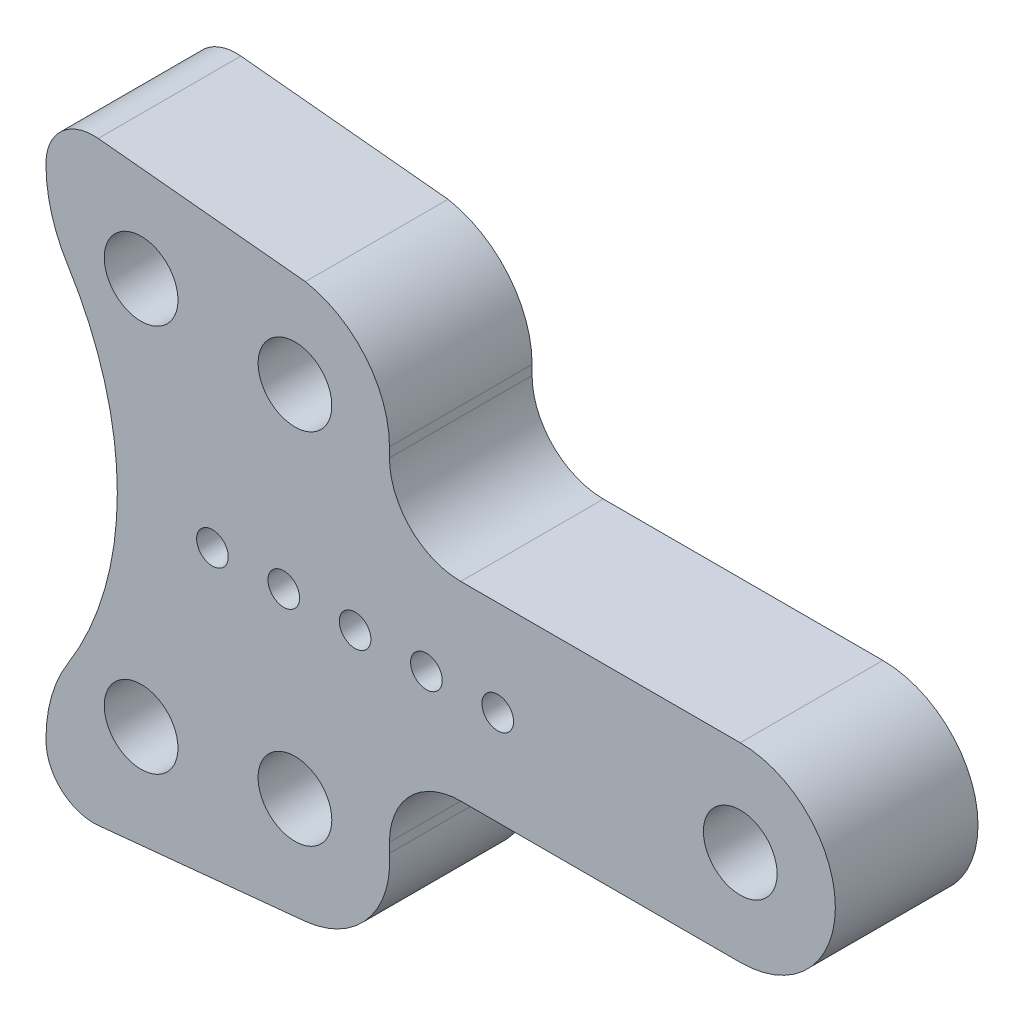
from build123d import *

# Parameters (mm, degrees)
SZKIC1_R                    = 1.55
DODANIE_WYCI_GNI_CIE1_DEPTH = 6
DODANIE_WYCI_GNI_CIE2_DEPTH = 6
WYTNIJ_WYCI_GNI_CIE3_START  = -10
SZKIC2_R                    = 0.665
SZKIC2_R_2                  = 1.55
WYTNIJ_WYCI_GNI_CIE3_DEPTH  = 10
SZYK_LINIOWY1_OUTLINE_R     = 0.665
SZYK_LINIOWY1_DEPTH         = 6
SZKIC6_R                    = 1.55
WYTNIJ_WYCI_GNI_CIE6_DEPTH  = 6


# Read off the part's stored shape, not the designer's step: Szyk liniowy1
with BuildPart() as part:
    # Szkic1 → Dodanie-wyciągnięcie1 (new body)
    with BuildSketch(Plane.XY):
        with BuildLine():
            Line((-166.275426397, 1549.053482816), (-188.475426397, 1549.053482816))
            ThreePointArc((-188.475426397, 1549.053482816), (-192.475426397, 1553.053482816), (-188.475426397, 1557.053482816))
            Line((-188.475426397, 1557.053482816), (-166.275426397, 1557.053482816))
            ThreePointArc((-166.275426397, 1557.053482816), (-162.275426397, 1553.053482816), (-166.275426397, 1549.053482816))
        make_face()
        with Locations((-166.275426397, 1553.053482816)):
            Circle(SZKIC1_R, mode=Mode.SUBTRACT)
    extrude(amount=DODANIE_WYCI_GNI_CIE1_DEPTH)

    # Szkic5 → Dodanie-wyciągnięcie2 (add)
    with BuildSketch(Plane.XY.offset(6)):
        with BuildLine():
            Line((-195.475426397, 1563.495915282), (-195.475426397, 1563.574683951))
            ThreePointArc((-195.475426397, 1563.574683951), (-194.81837577, 1565.056738938), (-193.278939414, 1565.565008766))
            Line((-193.278939414, 1565.565008766), (-191.112699272, 1565.351155235))
            Line((-191.112699272, 1565.351155235), (-184.565954248, 1564.704853604))
            ThreePointArc((-184.565954248, 1564.704853604), (-182.02952048, 1563.221328031), (-181.029706775, 1560.458228876))
            Line((-181.029706775, 1560.458228876), (-181.029706775, 1560.053482816))
            ThreePointArc((-181.029706775, 1560.053482816), (-180.151027119, 1557.932162472), (-178.029706775, 1557.053482816))
            Line((-178.029706775, 1557.053482816), (-178.029706775, 1549.053482816))
            ThreePointArc((-178.029706775, 1549.053482816), (-180.151027119, 1548.174803159), (-181.029706775, 1546.053482816))
            Line((-181.029706775, 1546.053482816), (-181.029706775, 1545.648736756))
            ThreePointArc((-181.029706775, 1545.648736756), (-181.939081075, 1542.810326939), (-184.565954248, 1541.402112028))
            Line((-184.565954248, 1541.402112028), (-188.141654627, 1541.049115084))
            Line((-188.141654627, 1541.049115084), (-193.278939414, 1540.541956866))
            ThreePointArc((-193.278939414, 1540.541956866), (-194.81837577, 1541.050226694), (-195.475426397, 1542.53228168))
            Line((-195.475426397, 1542.53228168), (-195.475426397, 1542.61105035))
            ThreePointArc((-195.475426397, 1542.61105035), (-195.242164639, 1544.267773032), (-194.560516381, 1545.795679033))
            ThreePointArc((-194.560516381, 1545.795679033), (-192.475426397, 1553.053482816), (-194.560516381, 1560.311286599))
            ThreePointArc((-194.560516381, 1560.311286599), (-195.242164639, 1561.839192599), (-195.475426397, 1563.495915282))
        make_face()
    extrude(amount=-DODANIE_WYCI_GNI_CIE2_DEPTH)

    # Szkic2 → Wytnij-wyciągnięcie3 (cut)
    with BuildSketch(Plane.XY.offset(6).offset(WYTNIJ_WYCI_GNI_CIE3_START)):
        with Locations((-188.475426397, 1553.053482816)):
            Circle(SZKIC2_R)
        with Locations((-166.275426397, 1553.053482816)):
            Circle(SZKIC2_R_2)
    extrude(amount=WYTNIJ_WYCI_GNI_CIE3_DEPTH, mode=Mode.SUBTRACT)

    # Szyk liniowy1 outline → Szyk liniowy1 (cut)
    with BuildSketch(Plane.XY):
        with Locations((-185.475426397, 1553.053482816)):
            Circle(SZYK_LINIOWY1_OUTLINE_R)
        with Locations((-182.475426397, 1553.053482816)):
            Circle(SZYK_LINIOWY1_OUTLINE_R)
        with Locations((-179.475426397, 1553.053482816)):
            Circle(SZYK_LINIOWY1_OUTLINE_R)
        with Locations((-176.475426397, 1553.053482816)):
            Circle(SZYK_LINIOWY1_OUTLINE_R)
    extrude(amount=SZYK_LINIOWY1_DEPTH, mode=Mode.SUBTRACT)

    # Szkic6 → Wytnij-wyciągnięcie6 (cut)
    with BuildSketch(Plane(origin=(0, 0, 0), x_dir=(-1, 0, 0), z_dir=(0, 0, -1))):
        with Locations((185.004427547, 1560.742573003)):
            Circle(SZKIC6_R)
        with Locations((191.475426395, 1561.355903175)):
            Circle(SZKIC6_R)
        with Locations(Location((191.475426395, 1545.035406583, 0), (0, 0, 180))):
            Circle(SZKIC6_R)
        with Locations(Location((185.004427547, 1545.648736756, 0), (0, 0, 180))):
            Circle(SZKIC6_R)
    extrude(amount=-WYTNIJ_WYCI_GNI_CIE6_DEPTH, mode=Mode.SUBTRACT)


solid = part.part
